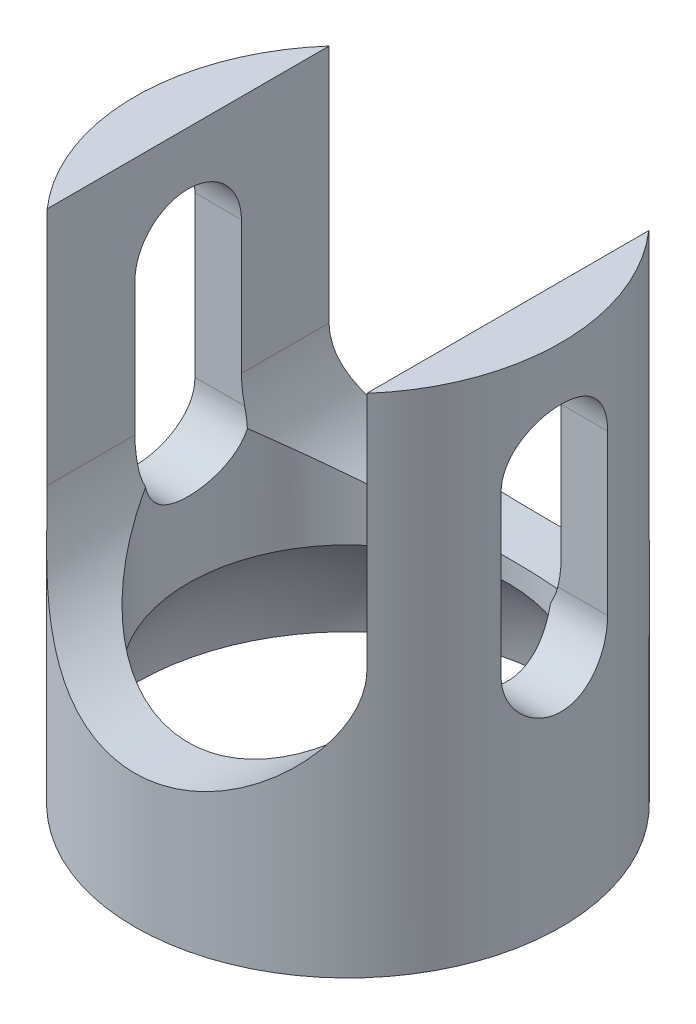
from build123d import *

# Parameters (mm, degrees)
SKETCH2_R               = 4
SKETCH2_R_2             = 3
BOSS_EXTRUDE1_DEPTH     = 9.5
CUT_EXTRUDE1_DEPTH      = 12.056672194
CUT_EXTRUDE1_DEPTH_BACK = 12.056672194
CUT_EXTRUDE2_DEPTH      = 12.056672352
CUT_EXTRUDE2_DEPTH_BACK = 12.056672352


with BuildPart() as part:
    # Sketch2 → Boss-Extrude1 (new body)
    with BuildSketch(Plane(origin=(0, 0, 0), x_dir=(1, 0, 0), z_dir=(0, 1, 0))):
        Circle(SKETCH2_R)
        Circle(SKETCH2_R_2, mode=Mode.SUBTRACT)
    extrude(amount=-BOSS_EXTRUDE1_DEPTH)

    # Sketch4 → Cut-Extrude1 (cut, two sides: drawn at the far end of the back side and taken through both)
    with BuildSketch(Plane(origin=(0, 0, 0), x_dir=(0, 0, -1), z_dir=(1, 0, 0)).offset(-CUT_EXTRUDE1_DEPTH_BACK)):
        with BuildLine():
            Line((-1, -2), (-1, -5))
            ThreePointArc((-1, -5), (0, -6), (1, -5))
            Line((1, -5), (1, -2))
            ThreePointArc((1, -2), (0, -1), (-1, -2))
        make_face()
    extrude(amount=CUT_EXTRUDE1_DEPTH + CUT_EXTRUDE1_DEPTH_BACK, mode=Mode.SUBTRACT)

    # Sketch5 → Cut-Extrude2 (cut, two sides: drawn at the far end of the back side and taken through both)
    with BuildSketch(Plane.XY.offset(-CUT_EXTRUDE2_DEPTH_BACK)):
        with BuildLine():
            Line((-3, 0), (-3, -4.5))
            add(Edge.make_bspline(
                [(-3, -4.5), (-3, -7), (0, -7), (3, -7), (3, -4.5)],
                knots=[3.141592654, 3.141592654, 3.141592654, 4.71238898, 4.71238898, 6.283185307, 6.283185307, 6.283185307], degree=2, weights=[1, 0.707106781, 1, 0.707106781, 1]))
            Line((3, -4.5), (3, 0))
            Line((3, 0), (-3, 0))
        make_face()
    extrude(amount=CUT_EXTRUDE2_DEPTH + CUT_EXTRUDE2_DEPTH_BACK, mode=Mode.SUBTRACT)

    # Sketch6 → Cut-Revolve3 (revolve, cut)
    with BuildSketch(Plane.XY):
        with BuildLine():
            Line((0, -14.054248689), (0, -6.054248689))
            ThreePointArc((0, -6.054248689), (-4, -10.054248689), (0, -14.054248689))
        make_face()
    revolve(axis=Axis((0, -5.027124344, 0), (0, -1, 0)), mode=Mode.SUBTRACT)


solid = part.part
